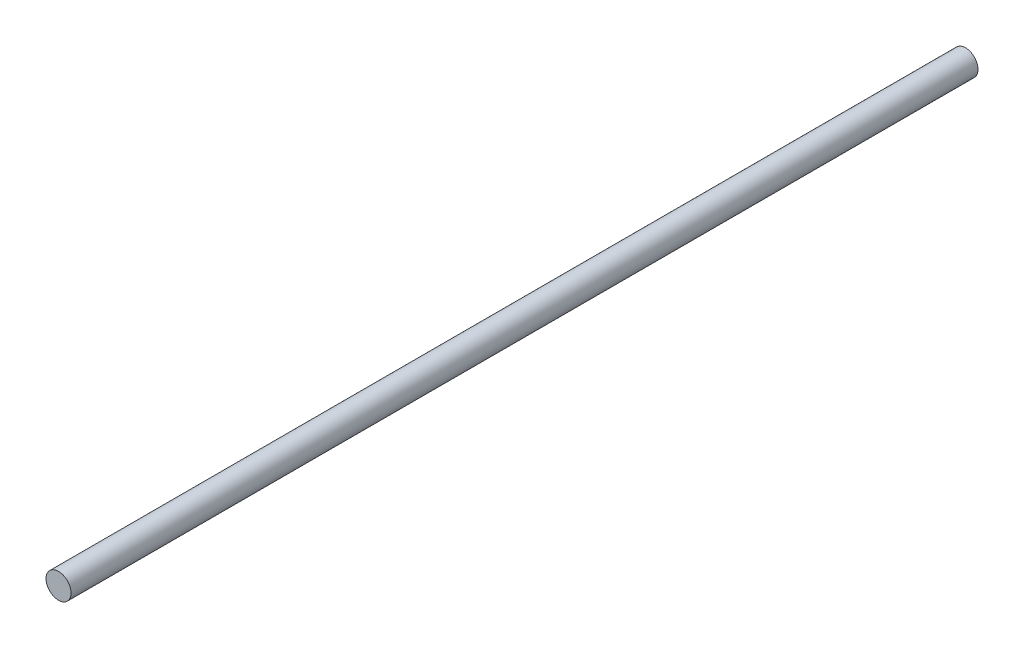
from build123d import *

# Parameters (mm, degrees)
SKETCH1_R           = 1.7526
BOSS_EXTRUDE1_DEPTH = 127


with BuildPart() as part:
    # Sketch1 → Boss-Extrude1 (new body)
    with BuildSketch(Plane.XY):
        Circle(SKETCH1_R)
    extrude(amount=BOSS_EXTRUDE1_DEPTH)


solid = part.part
